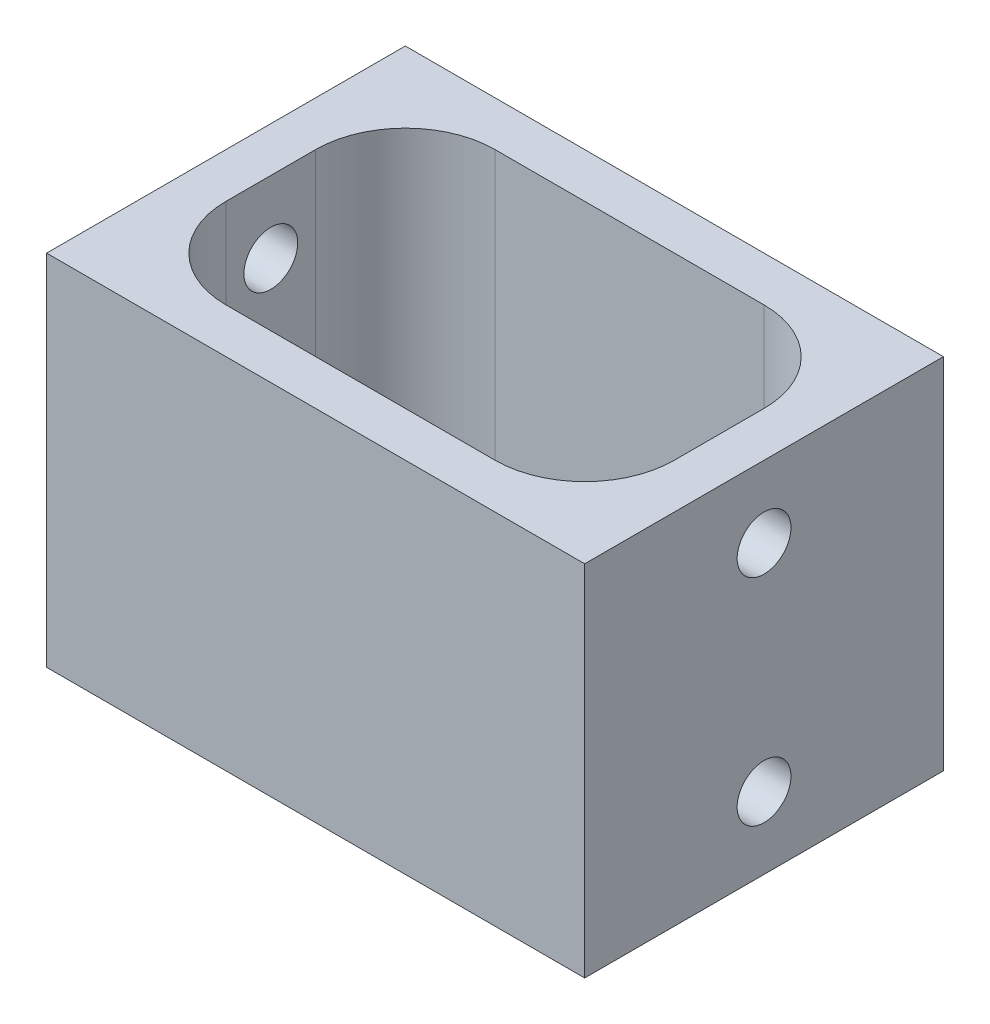
from build123d import *

# Parameters (mm, degrees)
BOSS_EXTRUDE1_OUTLINE_W   = 30
BOSS_EXTRUDE1_OUTLINE_H   = 20
BOSS_EXTRUDE1_OUTLINE_W_2 = 25
BOSS_EXTRUDE1_OUTLINE_H_2 = 15
BOSS_EXTRUDE1_DEPTH       = 20
SKETCH4_R                 = 1.5
CUT_EXTRUDE3_DEPTH        = 38.416573868
FILLET1_R                 = 5


# Read off the part's stored shape, not the designer's step: Boss-Extrude1
with BuildPart() as part:
    # Boss-Extrude1 outline → Boss-Extrude1 (new body)
    with BuildSketch(Plane(origin=(0, 0, 0), x_dir=(1, 0, 0), z_dir=(0, 1, 0))):
        Rectangle(BOSS_EXTRUDE1_OUTLINE_W, BOSS_EXTRUDE1_OUTLINE_H)
        Rectangle(BOSS_EXTRUDE1_OUTLINE_W_2, BOSS_EXTRUDE1_OUTLINE_H_2, mode=Mode.SUBTRACT)
    extrude(amount=BOSS_EXTRUDE1_DEPTH)

    # Sketch4 → Cut-Extrude3 (cut, through all)
    with BuildSketch(Plane(origin=(15, 0, 0), x_dir=(0, 0, -1), z_dir=(1, 0, 0))):
        with Locations((0, 16)):
            Circle(SKETCH4_R)
        with Locations((0, 4)):
            Circle(SKETCH4_R)
    extrude(amount=-CUT_EXTRUDE3_DEPTH, mode=Mode.SUBTRACT)

    # Fillet1
    fillet1_edges = [part.edges().sort_by_distance(p)[0] for p in [
        (12.5, 10, 7.5),
        (12.5, 10, -7.5),
        (-12.5, 10, -7.5),
        (-12.5, 10, 7.5),
    ]]
    fillet(fillet1_edges, radius=FILLET1_R)


solid = part.part
